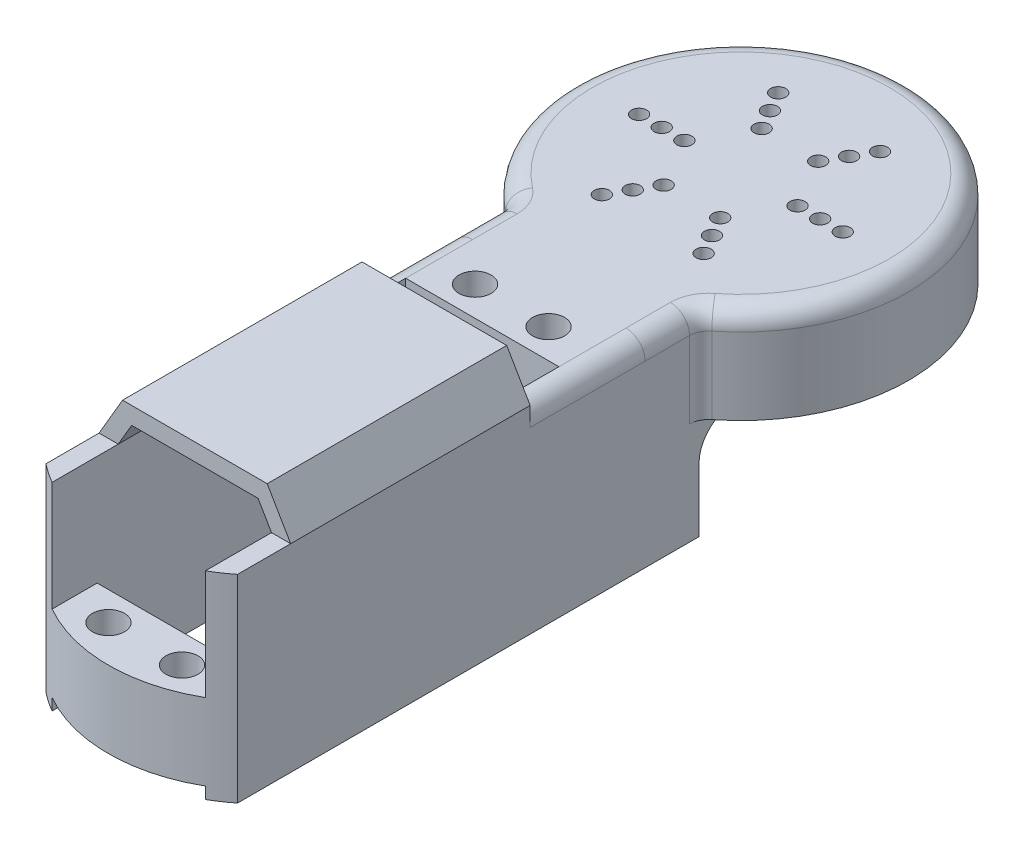
from build123d import *

# Parameters (mm, degrees)
SKETCH2_R           = 22.224999999999998
BOSS_EXTRUDE1_DEPTH = 12.7
SKETCH3_R           = 1.0000000000000009
SKETCH3_R_2         = 1.0000000000000002
SKETCH3_R_3         = 0.9999999999999998
CUT_EXTRUDE1_DEPTH  = 34.89972345019941
BOSS_EXTRUDE2_START = -19.05
BOSS_EXTRUDE2_DEPTH = 19.05
SKETCH8_R           = 17.779999999999998
CUT_EXTRUDE2_DEPTH  = 5.08
FILLET5_R           = 5.08
FILLET6_R           = 2.5399999999999996
FILLET7_R           = 2.5399999999999996
BOSS_EXTRUDE3_START = 7.211059999999999
BOSS_EXTRUDE3_DEPTH = 7.211059999999999
BOSS_EXTRUDE4_DEPTH = 25.4
SKETCH13_W          = 25.399999999999995
SKETCH13_H          = 26.261059999999993
BOSS_EXTRUDE5_DEPTH = 12.7
SKETCH15_W          = 20.32
SKETCH15_H          = 3.8100000000000023
CUT_EXTRUDE3_DEPTH  = 58.77305999999999
SKETCH16_W          = 20.32
SKETCH16_H          = 7.619999999999997
CUT_EXTRUDE4_DEPTH  = 1.5493999999999999
SKETCH18_R          = 2.1259799999999998
SKETCH18_R_2        = 2.12598
CUT_EXTRUDE5_DEPTH  = 38.09999999999998
SKETCH19_W          = 2.5399999999999974
SKETCH19_H          = 26.261059999999993
BOSS_EXTRUDE6_DEPTH = 39.370000000000005
BOSS_EXTRUDE7_DEPTH = 31.75
FILLET12_R          = 2.54
FILLET13_R          = 2.54
BOSS_EXTRUDE8_DEPTH = 10.15999999999999
SKETCH25_R          = 2.1259800000000015
SKETCH25_R_2        = 2.125980000000002
CUT_EXTRUDE6_DEPTH  = 10.15999999999999
BOSS_EXTRUDE9_DEPTH = 26.26106


# Some blends are built 0.0001 mm under size
with BuildPart() as part:
    # Sketch2 → Boss-Extrude1 (new body)
    with BuildSketch(Plane(origin=(0, 0, 0), x_dir=(1, 0, 0), z_dir=(0, 1, 0))):
        with Locations(Location((0, 0, 0), (0, 0, 270))):
            Circle(SKETCH2_R)
    extrude(amount=BOSS_EXTRUDE1_DEPTH)

    # Sketch3 → Cut-Extrude1 (cut, through all)
    with BuildSketch(Plane(origin=(0, 12.7, 0), x_dir=(1, 0, 0), z_dir=(0, 1, 0))):
        with Locations(Location((-6.750000000000055, -11.691342951089895, 0), (0, 0, 270))):
            Circle(SKETCH3_R)
        with Locations(Location((-5.2500000000000435, -9.093266739736585, 0), (0, 0, 270))):
            Circle(SKETCH3_R)
        with Locations(Location((-3.7500000000000306, -6.495190528383274, 0), (0, 0, 270))):
            Circle(SKETCH3_R_2)
        with Locations(Location((-13.5, -9.2e-16, 0), (0, 0, 270))):
            Circle(SKETCH3_R_3)
        with Locations(Location((-10.5, -9.2e-16, 0), (0, 0, 270))):
            Circle(SKETCH3_R_3)
        with Locations(Location((-7.5, -9.2e-16, 0), (0, 0, 270))):
            Circle(SKETCH3_R_3)
        with Locations(Location((-3.7499999999999396, 6.495190528383324, 0), (0, 0, 270))):
            Circle(SKETCH3_R_3)
        with Locations(Location((-5.2499999999999165, 9.093266739736652, 0), (0, 0, 270))):
            Circle(SKETCH3_R)
        with Locations(Location((-6.749999999999892, 11.69134295108998, 0), (0, 0, 270))):
            Circle(SKETCH3_R)
        with Locations(Location((6.750000000000136, 11.69134295108984, 0), (0, 0, 270))):
            Circle(SKETCH3_R)
        with Locations(Location((5.250000000000107, 9.093266739736544, 0), (0, 0, 270))):
            Circle(SKETCH3_R)
        with Locations(Location((3.750000000000076, 6.495190528383245, 0), (0, 0, 270))):
            Circle(SKETCH3_R_2)
        with Locations(Location((13.5, -9.2e-16, 0), (0, 0, 270))):
            Circle(SKETCH3_R_3)
        with Locations(Location((10.5, -9.2e-16, 0), (0, 0, 270))):
            Circle(SKETCH3_R_3)
        with Locations(Location((7.5, -9.2e-16, 0), (0, 0, 270))):
            Circle(SKETCH3_R_3)
        with Locations(Location((3.749999999999985, -6.4951905283833, 0), (0, 0, 270))):
            Circle(SKETCH3_R_2)
        with Locations(Location((5.24999999999998, -9.09326673973662, 0), (0, 0, 270))):
            Circle(SKETCH3_R)
        with Locations(Location((6.749999999999973, -11.69134295108994, 0), (0, 0, 270))):
            Circle(SKETCH3_R)
    extrude(amount=-CUT_EXTRUDE1_DEPTH, mode=Mode.SUBTRACT)

    # Sketch4 → Boss-Extrude2 (add)
    with BuildSketch(Plane(origin=(0, 12.7, 0), x_dir=(1, 0, 0), z_dir=(0, 1, 0)).offset(BOSS_EXTRUDE2_START)):
        with BuildLine():
            Line((-12.7, -18.23898640275824), (-12.7, -25.4))
            Line((-12.7, -25.4), (12.7, -25.4))
            Line((12.7, -25.4), (12.7, -18.23898640275824))
            ThreePointArc((12.7, -18.23898640275824), (1.36e-15, -22.224999999999998), (-12.7, -18.23898640275824))
        make_face()
    extrude(amount=BOSS_EXTRUDE2_DEPTH)

    # Sketch8 → Cut-Extrude2 (cut)
    with BuildSketch(Plane.XZ):
        with Locations(Location((0, 0, 0), (0, 0, 270))):
            Circle(SKETCH8_R)
    extrude(amount=-CUT_EXTRUDE2_DEPTH, mode=Mode.SUBTRACT)

    # Fillet5
    # the kernel refuses this fillet: 5.08 mm, written as the material it adds along each edge
    with BuildSketch(Plane(origin=(0, 0, 0), x_dir=(0.9228165811173926, 0, 0.3852396106513539), z_dir=(0.3852396106513539, 0, -0.9228165811173926))) as fillet5_piece_1_section:
        with BuildLine():
            CenterArc((17.144999999999996, 5.040156247578053), FILLET5_R, 277.1807557814583, 82.81924421854174)
            Line((22.224999999999998, 5.040156247578053), (22.225000000000648, 0))
            Line((22.225000000000648, 0), (17.779999999999994, 7.11e-15))
        make_face()
    fillet5_piece_1 = revolve(axis=Axis((0, 0, 0), (0, -1, 0)), revolution_arc=134.68276722332823, mode=Mode.PRIVATE)
    fillet5_piece_1 = split(fillet5_piece_1, bisect_by=Plane(origin=(-12.7, -1.6733318741959158, 20.962619999999998), z_dir=(1, 0, 0)), keep=Keep.TOP, mode=Mode.PRIVATE)
    fillet5_piece_1 = split(fillet5_piece_1, bisect_by=Plane(origin=(12.7, -1.6733318741959158, 20.962619999999998), z_dir=(-1, 0, 0)), keep=Keep.TOP, mode=Mode.PRIVATE)
    add(fillet5_piece_1)

    # Fillet6
    fillet6_edges = [part.edges().sort_by_distance(p)[0] for p in [
        (-12.699999999999998, 6.35, 18.238986402758243),
        (12.7, 6.35, 18.23898640275824),
    ]]
    fillet(fillet6_edges, radius=FILLET6_R)

    # Fillet7
    fillet7_edges = [part.edges().sort_by_distance(p)[0] for p in [
        (6.8e-15, 12.7, -22.224999999999998),
        (-12.7, 12.7, 22.460220604576516),
        (12.957258732946789, 12.7, 18.406577524633107),
        (-12.957258732946793, 12.7, 18.4065775246331),
        (12.7, 12.7, 22.460220604576516),
    ]]
    fillet(fillet7_edges, radius=FILLET7_R)

    # Sketch9 → Boss-Extrude3 (add)
    with BuildSketch(Plane.XZ.offset(6.350000000000001).offset(BOSS_EXTRUDE3_START)):
        with BuildLine():
            Line((12.699999999999998, 18.238986402758243), (12.7, 25.4))
            Line((12.7, 25.4), (-12.7, 25.4))
            Line((-12.7, 25.4), (-12.699999999999998, 18.23898640275824))
            ThreePointArc((-12.699999999999998, 18.23898640275824), (1.36e-15, 22.225), (12.699999999999998, 18.238986402758243))
        make_face()
    extrude(amount=-BOSS_EXTRUDE3_DEPTH)

    # Sketch10 → Boss-Extrude4 (add)
    with BuildSketch(Plane(origin=(12.7, 0, 0), x_dir=(0, 0, -1), z_dir=(1, 0, 0))):
        Polygon((-25.4, 12.7), (-38.1, -0.8610600000000003), (-38.1, -13.56106), (-25.4, -13.56106), align=None)
    extrude(amount=-BOSS_EXTRUDE4_DEPTH)

    # Sketch13 → Boss-Extrude5 (add)
    with BuildSketch(Plane.XY.offset(38.1)):
        with Locations((0, -0.4305300000000001)):
            Rectangle(SKETCH13_W, SKETCH13_H)
    extrude(amount=-BOSS_EXTRUDE5_DEPTH)

    # Sketch15 → Cut-Extrude3 (cut)
    with BuildSketch(Plane(origin=(0, 12.7, 0), x_dir=(1, 0, 0), z_dir=(0, 1, 0))):
        with Locations((0, -36.195)):
            Rectangle(SKETCH15_W, SKETCH15_H)
    extrude(amount=-CUT_EXTRUDE3_DEPTH, mode=Mode.SUBTRACT)

    # Sketch16 → Cut-Extrude4 (cut)
    with BuildSketch(Plane.XZ.offset(13.56106)):
        with Locations((0, 30.48)):
            Rectangle(SKETCH16_W, SKETCH16_H)
    extrude(amount=-CUT_EXTRUDE4_DEPTH, mode=Mode.SUBTRACT)

    # Sketch18 → Cut-Extrude5 (cut)
    with BuildSketch(Plane.XZ.offset(12.011660000000001)):
        with Locations(Location((-4.8742600000000005, 30.375860000000003, 0), (0, 0, 270))):
            Circle(SKETCH18_R)
        with Locations(Location((4.8742600000000005, 30.375860000000003, 0), (0, 0, 270))):
            Circle(SKETCH18_R_2)
    extrude(amount=-CUT_EXTRUDE5_DEPTH, mode=Mode.SUBTRACT)

    # Sketch19 → Boss-Extrude6 (add)
    with BuildSketch(Plane.XY.offset(38.1)):
        with Locations((-11.43, -0.4305300000000001)):
            Rectangle(SKETCH19_W, SKETCH19_H)
        Polygon((10.16, 12.7), (10.159999999999998, -13.56106), (12.7, -13.56106), (12.7, 12.7), align=None)
    extrude(amount=BOSS_EXTRUDE6_DEPTH)

    # Sketch20 → Boss-Extrude7 (add)
    with BuildSketch(Plane.XY.offset(40.64)):
        Polygon((-12.7, 12.7), (-9.5885, 18.033999999999995), (9.588500000000002, 18.033999999999995), (12.7, 12.7), (10.16, 12.7), (8.382000000000001, 15.747999999999998), (-8.382000000000001, 15.747999999999994), (-10.16, 12.7), align=None)
    extrude(amount=BOSS_EXTRUDE7_DEPTH)

    # Fillet12
    fillet12_edges = [part.edges().sort_by_distance(p)[0] for p in [
        (12.699999999999998, 12.699999999999998, 33.02),
    ]]
    fillet(fillet12_edges, radius=FILLET12_R - 0.0001)  # a hair under: the kernel refuses the full size

    # Fillet13
    fillet13_edges = [part.edges().sort_by_distance(p)[0] for p in [
        (-12.699999999999998, 12.699999999999998, 33.02),
    ]]
    fillet(fillet13_edges, radius=FILLET13_R - 0.0001)  # a hair under: the kernel refuses the full size

    # Sketch24 → Boss-Extrude8 (add)
    with BuildSketch(Plane.XZ.offset(12.011660000000001)):
        with BuildLine():
            Line((-10.16, 75.184), (-10.16, 81.15627063227116))
            ThreePointArc((-10.16, 81.15627063227116), (1.25e-15, 83.87080000000003), (10.159999999999998, 81.15627063227116))
            Line((10.159999999999998, 81.15627063227116), (10.16, 75.184))
            Line((10.16, 75.184), (-10.16, 75.184))
        make_face()
    extrude(amount=-BOSS_EXTRUDE8_DEPTH)

    # Sketch25 → Cut-Extrude6 (cut)
    with BuildSketch(Plane.XZ.offset(12.011660000000001)):
        with Locations(Location((-4.8742600000000005, 78.97622, 0), (0, 0, 270))):
            Circle(SKETCH25_R)
        with Locations(Location((4.874260000000001, 78.97622, 0), (0, 0, 270))):
            Circle(SKETCH25_R_2)
    extrude(amount=-CUT_EXTRUDE6_DEPTH, mode=Mode.SUBTRACT)

    # Sketch26 → Boss-Extrude9 (add)
    with BuildSketch(Plane.XZ.offset(13.56106)):
        with BuildLine():
            ThreePointArc((-12.7, 79.4273190663087), (-11.462644475833708, 80.33975279689817), (-10.16, 81.15627063227114))
            Line((-10.16, 81.15627063227114), (-10.16, 77.47000000000001))
            Line((-10.16, 77.47000000000001), (-12.7, 77.47000000000001))
            Line((-12.7, 77.47000000000001), (-12.7, 79.4273190663087))
        make_face()
        with BuildLine():
            ThreePointArc((12.7, 79.4273190663087), (11.4626444758337, 80.33975279689815), (10.159999999999991, 81.15627063227114))
            Line((10.159999999999998, 81.15627063227116), (10.159999999999998, 77.47000000000001))
            Line((10.159999999999998, 77.47000000000001), (12.7, 77.47000000000001))
            Line((12.7, 77.47000000000001), (12.7, 79.4273190663087))
        make_face()
    extrude(amount=-BOSS_EXTRUDE9_DEPTH)


solid = part.part
